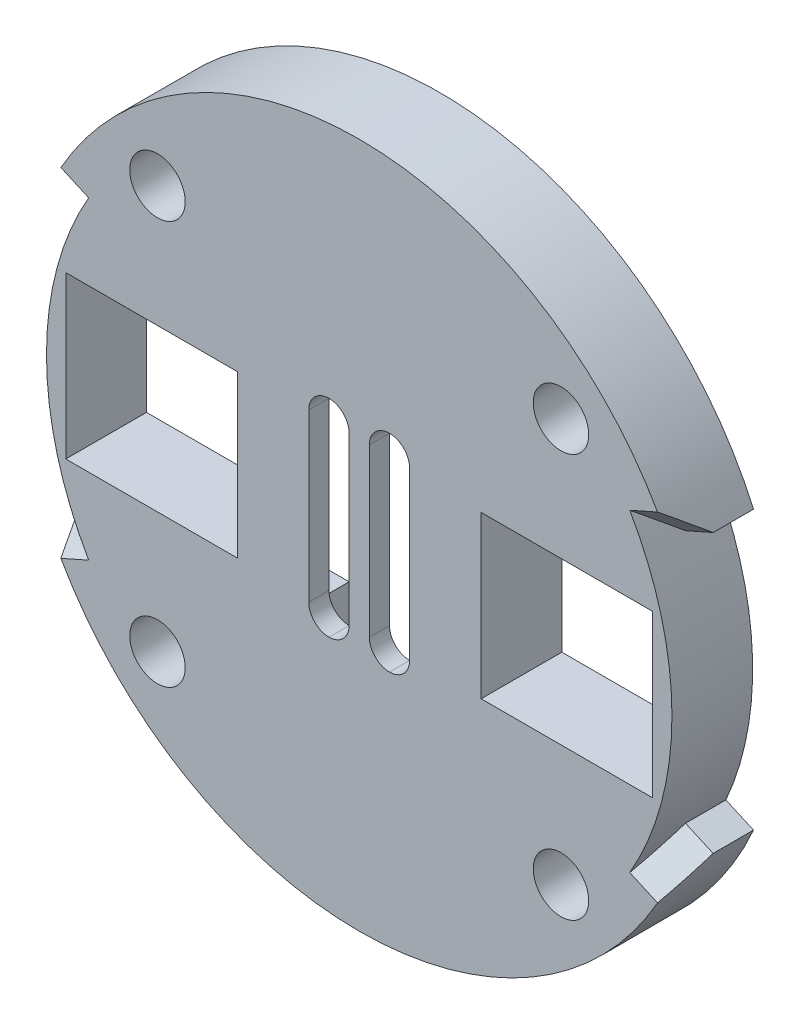
from build123d import *
from OCP.BRepFilletAPI import BRepFilletAPI_MakeChamfer

# Parameters (mm, degrees)
BOSS_EXTRUDE1_DEPTH = 8
SKETCH3_W           = 17
SKETCH3_H           = 16
CUT_EXTRUDE1_DEPTH  = 8
SKETCH3_5_R         = 1.5
CUT_EXTRUDE3_DEPTH  = 8
SKETCH3_6_R         = 2.75
CUT_EXTRUDE4_DEPTH  = 6
CHAMFER1_SIZE       = 4
CHAMFER1_SIZE2      = 3.356398525
SKETCH4_W           = 18
SKETCH4_H           = 60
CUT_EXTRUDE6_DEPTH  = 6
SKETCH5_W           = 4
SKETCH5_H           = 20.5
CUT_EXTRUDE8_DEPTH  = 8
FILLET1_R           = 2
SKETCH6_W           = 22
SKETCH6_H           = 25
CUT_EXTRUDE10_DEPTH = 2


with BuildPart() as part:
    # Sketch1 → Boss-Extrude1 (new body)
    with BuildSketch(Plane.XY):
        with BuildLine():
            Line((-32, 13.367307057), (-29.257142857, 12.152097325))
            ThreePointArc((-29.257142857, 12.152097325), (-31.914285714, -0.405069911), (-29.257142857, -12.962237146))
            Line((-29.257142857, -12.962237146), (-32, -14.177446879))
            ThreePointArc((-32, -14.177446879), (-0.914285714, -34.405069911), (30.171428571, -14.177446879))
            Line((30.171428571, -14.177446879), (27.428571429, -12.962237146))
            ThreePointArc((27.428571429, -12.962237146), (30.085714286, -0.405069911), (27.428571429, 12.152097325))
            Line((27.428571429, 12.152097325), (30.171428571, 13.367307057))
            ThreePointArc((30.171428571, 13.367307057), (-0.914285714, 33.594930089), (-32, 13.367307057))
        make_face()
    extrude(amount=BOSS_EXTRUDE1_DEPTH)

    # Sketch3 → Cut-Extrude1 (cut)
    with BuildSketch(Plane.XY.offset(8)):
        with Locations((-21.5, -0.405069911)):
            Rectangle(SKETCH3_W, SKETCH3_H)
        with Locations((19.671428571, -0.405069911)):
            Rectangle(SKETCH3_W, SKETCH3_H)
    extrude(amount=-CUT_EXTRUDE1_DEPTH, mode=Mode.SUBTRACT)

    # Sketch3<5> → Cut-Extrude3 (cut)
    with BuildSketch(Plane.XY.offset(8)):
        with Locations(Location((19.085714286, 19.594930089, 0), (0, 0, 180))):
            Circle(SKETCH3_5_R)
        with Locations((-20.914285714, 19.594930089)):
            Circle(SKETCH3_5_R)
        with Locations((19.085714286, -20.405069911)):
            Circle(SKETCH3_5_R)
        with Locations((-20.914285714, -20.405069911)):
            Circle(SKETCH3_5_R)
    extrude(amount=-CUT_EXTRUDE3_DEPTH, mode=Mode.SUBTRACT)

    # Sketch3<6> → Cut-Extrude4 (cut)
    with BuildSketch(Plane.XY.offset(8)):
        with Locations((19.085714286, 19.594930089)):
            Circle(SKETCH3_6_R)
        with Locations((19.085714286, -20.405069911)):
            Circle(SKETCH3_6_R)
        with Locations((-20.914285714, 19.594930089)):
            Circle(SKETCH3_6_R)
        with Locations((-20.914285714, -20.405069911)):
            Circle(SKETCH3_6_R)
    extrude(amount=-CUT_EXTRUDE4_DEPTH, mode=Mode.SUBTRACT)

    # Chamfer1: one chamfer whose edges measure the first distance from different faces: ONE call of the kernel's chamfer builder (chamfer() names one face for all edges)
    chamfer1_edges_1 = [part.edges().sort_by_distance(p)[0] for p in [
        (28.8, 12.759702191, 8),
    ]]
    chamfer1_side_1 = [part.faces().sort_by_distance(p)[0] for p in [
        (28.8, 12.759702191, 4),
    ]]
    chamfer1_edges_2 = [part.edges().sort_by_distance(p)[0] for p in [
        (-30.628571429, 12.759702191, 8),
    ]]
    chamfer1_side_2 = [part.faces().sort_by_distance(p)[0] for p in [
        (-30.628571429, 12.759702191, 4),
    ]]
    chamfer1_edges_3 = [part.edges().sort_by_distance(p)[0] for p in [
        (-30.628571429, -13.569842013, 8),
    ]]
    chamfer1_side_3 = [part.faces().sort_by_distance(p)[0] for p in [
        (-30.628571429, -13.569842013, 4),
    ]]
    chamfer1_edges_4 = [part.edges().sort_by_distance(p)[0] for p in [
        (28.8, -13.569842013, 8),
    ]]
    chamfer1_side_4 = [part.faces().sort_by_distance(p)[0] for p in [
        (28.8, -13.569842013, 4),
    ]]
    chamfer1 = BRepFilletAPI_MakeChamfer(part.part.solid().wrapped)
    for e in chamfer1_edges_1:
        chamfer1.Add(CHAMFER1_SIZE, CHAMFER1_SIZE2, e.wrapped, chamfer1_side_1[0].wrapped)  # the first distance lies on this face
    for e in chamfer1_edges_2:
        chamfer1.Add(CHAMFER1_SIZE, CHAMFER1_SIZE2, e.wrapped, chamfer1_side_2[0].wrapped)  # the first distance lies on this face
    for e in chamfer1_edges_3:
        chamfer1.Add(CHAMFER1_SIZE, CHAMFER1_SIZE2, e.wrapped, chamfer1_side_3[0].wrapped)  # the first distance lies on this face
    for e in chamfer1_edges_4:
        chamfer1.Add(CHAMFER1_SIZE, CHAMFER1_SIZE2, e.wrapped, chamfer1_side_4[0].wrapped)  # the first distance lies on this face
    add(Compound.cast(chamfer1.Shape()), mode=Mode.REPLACE)

    # Sketch4 → Cut-Extrude6 (cut)
    with BuildSketch(Plane.XY):
        with Locations((-0.914285714, -0.405069911)):
            Rectangle(SKETCH4_W, SKETCH4_H)
    extrude(amount=CUT_EXTRUDE6_DEPTH, mode=Mode.SUBTRACT)

    # Sketch5 → Cut-Extrude8 (cut)
    with BuildSketch(Plane.XY):
        with Locations((2.085714286, -0.405069911)):
            Rectangle(SKETCH5_W, SKETCH5_H)
        with Locations((-3.914285714, -0.405069911)):
            Rectangle(SKETCH5_W, SKETCH5_H)
    extrude(amount=CUT_EXTRUDE8_DEPTH, mode=Mode.SUBTRACT)

    # Fillet1
    fillet1_edges = [part.edges().sort_by_distance(p)[0] for p in [
        (0.085714286, -10.655069911, 7),
        (4.085714286, -10.655069911, 7),
        (4.085714286, 9.844930089, 7),
        (0.085714286, 9.844930089, 7),
        (-1.914285714, -10.655069911, 7),
        (-5.914285714, -10.655069911, 7),
        (-1.914285714, 9.844930089, 7),
        (-5.914285714, 9.844930089, 7),
    ]]
    fillet(fillet1_edges, radius=FILLET1_R - 0.0001)  # a hair under: the kernel refuses the full size

    # Sketch6 → Cut-Extrude10 (cut)
    with BuildSketch(Plane(origin=(0, 0, 0), x_dir=(-1, 0, 0), z_dir=(0, 0, -1))):
        with Locations((0.914285714, -0.405069911)):
            Rectangle(SKETCH6_W, SKETCH6_H)
    extrude(amount=-CUT_EXTRUDE10_DEPTH, mode=Mode.SUBTRACT)


solid = part.part
